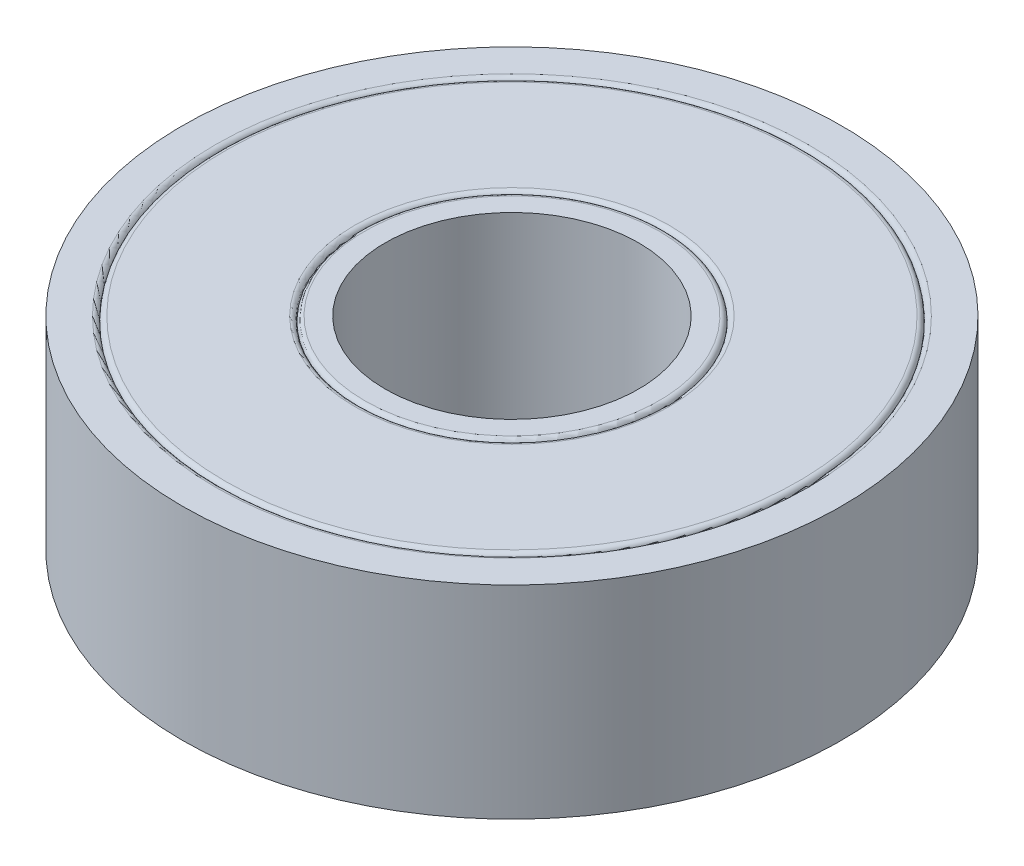
from build123d import *

# Parameters (mm, degrees)
SKETCH2_R           = 13
SKETCH2_R_2         = 5
BOSS_EXTRUDE1_DEPTH = 8
SKETCH1_R           = 11.5
SKETCH1_R_2         = 6
SKETCH1_R_3         = 2.75
CUT_EXTRUDE2_DEPTH  = 10
SKETCH4_R           = 11.5
SKETCH4_R_2         = 6
CUT_EXTRUDE3_DEPTH  = 1
SKETCH5_R           = 11.5
SKETCH5_R_2         = 6
CUT_EXTRUDE4_DEPTH  = 1
FILLET1_R           = 0.2
FILLET2_R           = 0.2
SKETCH7_R           = 11.5
SKETCH7_R_2         = 6
BOSS_EXTRUDE2_DEPTH = 0.5
FILLET3_R           = 0.2
FILLET4_R           = 0.2
SKETCH9_R           = 11.5
SKETCH9_R_2         = 6
BOSS_EXTRUDE3_DEPTH = 0.5
FILLET5_R           = 0.2
FILLET6_R           = 0.2
FILLET7_R           = 0.2
FILLET8_R           = 0.2


with BuildPart() as part:
    # Sketch2 → Boss-Extrude1 (new body)
    with BuildSketch(Plane(origin=(0, 0, 0), x_dir=(1, 0, 0), z_dir=(0, 1, 0))):
        with Locations(Location((0, 0, 0), (0, 0, 270))):
            Circle(SKETCH2_R)
        with Locations(Location((0, 0, 0), (0, 0, 270))):
            Circle(SKETCH2_R_2, mode=Mode.SUBTRACT)
    extrude(amount=BOSS_EXTRUDE1_DEPTH)

    # Sketch1 → Cut-Extrude2 (cut)
    with BuildSketch(Plane(origin=(0, 8, 0), x_dir=(1, 0, 0), z_dir=(0, 1, 0))):
        with Locations(Location((0, 0, 0), (0, 0, 270))):
            Circle(SKETCH1_R)
        with Locations(Location((0, 0, 0), (0, 0, 270))):
            Circle(SKETCH1_R_2, mode=Mode.SUBTRACT)
        with Locations(Location((-8.75, 0, 0), (0, 0, 270))):
            Circle(SKETCH1_R_3, mode=Mode.SUBTRACT)
        with Locations(Location((-6.702888877, 5.624391585, 0), (0, 0, 270))):
            Circle(SKETCH1_R_3, mode=Mode.SUBTRACT)
        with Locations(Location((-1.519421555, 8.617067839, 0), (0, 0, 270))):
            Circle(SKETCH1_R_3, mode=Mode.SUBTRACT)
        with Locations(Location((4.375, 7.577722283, 0), (0, 0, 270))):
            Circle(SKETCH1_R_3, mode=Mode.SUBTRACT)
        with Locations(Location((8.222310432, 2.992676254, 0), (0, 0, 270))):
            Circle(SKETCH1_R_3, mode=Mode.SUBTRACT)
        with Locations(Location((8.222310432, -2.992676254, 0), (0, 0, 270))):
            Circle(SKETCH1_R_3, mode=Mode.SUBTRACT)
        with Locations(Location((4.375, -7.577722283, 0), (0, 0, 270))):
            Circle(SKETCH1_R_3, mode=Mode.SUBTRACT)
        with Locations(Location((-1.519421555, -8.617067839, 0), (0, 0, 270))):
            Circle(SKETCH1_R_3, mode=Mode.SUBTRACT)
        with Locations(Location((-6.702888877, -5.624391585, 0), (0, 0, 270))):
            Circle(SKETCH1_R_3, mode=Mode.SUBTRACT)
    extrude(amount=-CUT_EXTRUDE2_DEPTH, mode=Mode.SUBTRACT)


with BuildPart() as cut_extrude2_piece_1:
    # of the separate pieces the step leaves, piece 1, a body of its own (cut_extrude2_pieces)
    add(part.part.solids().sort_by_distance((0, 0, 13))[0])

    # Fillet2
    fillet2_edges = [cut_extrude2_piece_1.edges().sort_by_distance(p)[0] for p in [
        (0, 8, -11.5),
    ]]
    fillet(fillet2_edges, radius=FILLET2_R)



with BuildPart() as cut_extrude2_piece_2:
    # of the separate pieces the step leaves, piece 2, a body of its own (cut_extrude2_pieces)
    add(part.part.solids().sort_by_distance((0, 0, 6))[0])

    # Fillet1
    fillet1_edges = [cut_extrude2_piece_2.edges().sort_by_distance(p)[0] for p in [
        (0, 8, -6),
    ]]
    fillet(fillet1_edges, radius=FILLET1_R)


with BuildPart() as cut_extrude2_piece_3:
    # of the separate pieces the step leaves, piece 3, a body of its own (cut_extrude2_pieces)
    add(part.part.solids().sort_by_distance((-1.519421555, 0, 11.367067839))[0])


with BuildPart() as cut_extrude2_piece_4:
    # of the separate pieces the step leaves, piece 4, a body of its own (cut_extrude2_pieces)
    add(part.part.solids().sort_by_distance((-6.702888877, 0, 8.374391585))[0])


with BuildPart() as cut_extrude2_piece_5:
    # of the separate pieces the step leaves, piece 5, a body of its own (cut_extrude2_pieces)
    add(part.part.solids().sort_by_distance((8.222310432, 0, -0.242676254))[0])


with BuildPart() as cut_extrude2_piece_6:
    # of the separate pieces the step leaves, piece 6, a body of its own (cut_extrude2_pieces)
    add(part.part.solids().sort_by_distance((4.375, 0, -4.827722283))[0])


with BuildPart() as cut_extrude2_piece_7:
    # of the separate pieces the step leaves, piece 7, a body of its own (cut_extrude2_pieces)
    add(part.part.solids().sort_by_distance((-8.75, 0, 2.75))[0])


with BuildPart() as cut_extrude2_piece_8:
    # of the separate pieces the step leaves, piece 8, a body of its own (cut_extrude2_pieces)
    add(part.part.solids().sort_by_distance((8.222310432, 0, 5.742676254))[0])


with BuildPart() as cut_extrude2_piece_9:
    # of the separate pieces the step leaves, piece 9, a body of its own (cut_extrude2_pieces)
    add(part.part.solids().sort_by_distance((-6.702888877, 0, -2.874391585))[0])


with BuildPart() as cut_extrude2_piece_10:
    # of the separate pieces the step leaves, piece 10, a body of its own (cut_extrude2_pieces)
    add(part.part.solids().sort_by_distance((4.375, 0, 10.327722283))[0])


with BuildPart() as cut_extrude2_piece_11:
    # of the separate pieces the step leaves, piece 11, a body of its own (cut_extrude2_pieces)
    add(part.part.solids().sort_by_distance((-1.519421555, 0, -5.867067839))[0])


with BuildPart() as cut_extrude3_tool:
    # Sketch4 → Cut-Extrude3 (new body)
    with BuildSketch(Plane(origin=(0, 8, 0), x_dir=(1, 0, 0), z_dir=(0, 1, 0))):
        with Locations(Location((0, 0, 0), (0, 0, 270))):
            Circle(SKETCH4_R)
        with Locations(Location((0, 0, 0), (0, 0, 270))):
            Circle(SKETCH4_R_2, mode=Mode.SUBTRACT)
    extrude(amount=-CUT_EXTRUDE3_DEPTH)


with BuildPart() as cut_extrude2_piece_3_1:
    add(cut_extrude2_piece_3.part)

    # Cut-Extrude3: cut by cut_extrude3_tool
    add(cut_extrude3_tool.part, mode=Mode.SUBTRACT)


with BuildPart() as cut_extrude2_piece_4_1:
    add(cut_extrude2_piece_4.part)

    # Cut-Extrude3: cut by cut_extrude3_tool
    add(cut_extrude3_tool.part, mode=Mode.SUBTRACT)


with BuildPart() as cut_extrude2_piece_5_1:
    add(cut_extrude2_piece_5.part)

    # Cut-Extrude3: cut by cut_extrude3_tool
    add(cut_extrude3_tool.part, mode=Mode.SUBTRACT)


with BuildPart() as cut_extrude2_piece_6_1:
    add(cut_extrude2_piece_6.part)

    # Cut-Extrude3: cut by cut_extrude3_tool
    add(cut_extrude3_tool.part, mode=Mode.SUBTRACT)


with BuildPart() as cut_extrude2_piece_7_1:
    add(cut_extrude2_piece_7.part)

    # Cut-Extrude3: cut by cut_extrude3_tool
    add(cut_extrude3_tool.part, mode=Mode.SUBTRACT)


with BuildPart() as cut_extrude2_piece_8_1:
    add(cut_extrude2_piece_8.part)

    # Cut-Extrude3: cut by cut_extrude3_tool
    add(cut_extrude3_tool.part, mode=Mode.SUBTRACT)


with BuildPart() as cut_extrude2_piece_9_1:
    add(cut_extrude2_piece_9.part)

    # Cut-Extrude3: cut by cut_extrude3_tool
    add(cut_extrude3_tool.part, mode=Mode.SUBTRACT)


with BuildPart() as cut_extrude2_piece_10_1:
    add(cut_extrude2_piece_10.part)

    # Cut-Extrude3: cut by cut_extrude3_tool
    add(cut_extrude3_tool.part, mode=Mode.SUBTRACT)


with BuildPart() as cut_extrude2_piece_11_1:
    add(cut_extrude2_piece_11.part)

    # Cut-Extrude3: cut by cut_extrude3_tool
    add(cut_extrude3_tool.part, mode=Mode.SUBTRACT)


with BuildPart() as cut_extrude4_tool:
    # Sketch5 → Cut-Extrude4 (new body)
    with BuildSketch(Plane.XZ):
        with Locations(Location((0, 0, 0), (0, 0, 90))):
            Circle(SKETCH5_R)
        with Locations(Location((0, 0, 0), (0, 0, 90))):
            Circle(SKETCH5_R_2, mode=Mode.SUBTRACT)
    extrude(amount=-CUT_EXTRUDE4_DEPTH)


with BuildPart() as cut_extrude2_piece_3_2:
    add(cut_extrude2_piece_3_1.part)

    # Cut-Extrude4: cut by cut_extrude4_tool
    add(cut_extrude4_tool.part, mode=Mode.SUBTRACT)


with BuildPart() as cut_extrude2_piece_4_2:
    add(cut_extrude2_piece_4_1.part)

    # Cut-Extrude4: cut by cut_extrude4_tool
    add(cut_extrude4_tool.part, mode=Mode.SUBTRACT)


with BuildPart() as cut_extrude2_piece_5_2:
    add(cut_extrude2_piece_5_1.part)

    # Cut-Extrude4: cut by cut_extrude4_tool
    add(cut_extrude4_tool.part, mode=Mode.SUBTRACT)


with BuildPart() as cut_extrude2_piece_6_2:
    add(cut_extrude2_piece_6_1.part)

    # Cut-Extrude4: cut by cut_extrude4_tool
    add(cut_extrude4_tool.part, mode=Mode.SUBTRACT)


with BuildPart() as cut_extrude2_piece_7_2:
    add(cut_extrude2_piece_7_1.part)

    # Cut-Extrude4: cut by cut_extrude4_tool
    add(cut_extrude4_tool.part, mode=Mode.SUBTRACT)


with BuildPart() as cut_extrude2_piece_8_2:
    add(cut_extrude2_piece_8_1.part)

    # Cut-Extrude4: cut by cut_extrude4_tool
    add(cut_extrude4_tool.part, mode=Mode.SUBTRACT)


with BuildPart() as cut_extrude2_piece_9_2:
    add(cut_extrude2_piece_9_1.part)

    # Cut-Extrude4: cut by cut_extrude4_tool
    add(cut_extrude4_tool.part, mode=Mode.SUBTRACT)


with BuildPart() as cut_extrude2_piece_10_2:
    add(cut_extrude2_piece_10_1.part)

    # Cut-Extrude4: cut by cut_extrude4_tool
    add(cut_extrude4_tool.part, mode=Mode.SUBTRACT)


with BuildPart() as cut_extrude2_piece_11_2:
    add(cut_extrude2_piece_11_1.part)

    # Cut-Extrude4: cut by cut_extrude4_tool
    add(cut_extrude4_tool.part, mode=Mode.SUBTRACT)


with BuildPart() as cut_extrude2_piece_1_1:
    add(cut_extrude2_piece_1.part)

    add(cut_extrude2_piece_2.part)  # Boss-Extrude2 merges Cut-Extrude2 piece 2
    # Sketch7 → Boss-Extrude2 (add)
    with BuildSketch(Plane(origin=(0, 8, 0), x_dir=(1, 0, 0), z_dir=(0, 1, 0))):
        with Locations(Location((0, 0, 0), (0, 0, 270))):
            Circle(SKETCH7_R)
        with Locations(Location((0, 0, 0), (0, 0, 270))):
            Circle(SKETCH7_R_2, mode=Mode.SUBTRACT)
    extrude(amount=-BOSS_EXTRUDE2_DEPTH)

    # Fillet3
    fillet3_edges = [cut_extrude2_piece_1_1.edges().sort_by_distance(p)[0] for p in [
        (0, 0, -6),
    ]]
    fillet(fillet3_edges, radius=FILLET3_R)

    # Fillet4
    fillet4_edges = [cut_extrude2_piece_1_1.edges().sort_by_distance(p)[0] for p in [
        (0, 0, -11.5),
    ]]
    fillet(fillet4_edges, radius=FILLET4_R)

    # Sketch9 → Boss-Extrude3 (add)
    with BuildSketch(Plane(origin=(0, 0, 0), x_dir=(-1, 0, 0), z_dir=(0, -1, 0))):
        with Locations(Location((0, 0, 0), (0, 0, 270))):
            Circle(SKETCH9_R)
        with Locations(Location((0, 0, 0), (0, 0, 270))):
            Circle(SKETCH9_R_2, mode=Mode.SUBTRACT)
    extrude(amount=-BOSS_EXTRUDE3_DEPTH)

    # Fillet5
    fillet5_edges = [cut_extrude2_piece_1_1.edges().sort_by_distance(p)[0] for p in [
        (0, 0, -11.5),
    ]]
    fillet(fillet5_edges, radius=FILLET5_R - 0.0001)  # a hair under: the kernel refuses the full size

    # Fillet6
    fillet6_edges = [cut_extrude2_piece_1_1.edges().sort_by_distance(p)[0] for p in [
        (0, 0, -6),
    ]]
    fillet(fillet6_edges, radius=FILLET6_R - 0.0001)  # a hair under: the kernel refuses the full size

    # Fillet7
    fillet7_edges = [cut_extrude2_piece_1_1.edges().sort_by_distance(p)[0] for p in [
        (0, 8, -6),
    ]]
    fillet(fillet7_edges, radius=FILLET7_R - 0.0001)  # a hair under: the kernel refuses the full size

    # Fillet8
    fillet8_edges = [cut_extrude2_piece_1_1.edges().sort_by_distance(p)[0] for p in [
        (0, 8, -11.5),
    ]]
    fillet(fillet8_edges, radius=FILLET8_R - 0.0001)  # a hair under: the kernel refuses the full size


solid = Compound([cut_extrude2_piece_3_2.part, cut_extrude2_piece_4_2.part, cut_extrude2_piece_5_2.part, cut_extrude2_piece_6_2.part, cut_extrude2_piece_7_2.part, cut_extrude2_piece_8_2.part, cut_extrude2_piece_9_2.part, cut_extrude2_piece_10_2.part, cut_extrude2_piece_11_2.part, cut_extrude2_piece_1_1.part])
